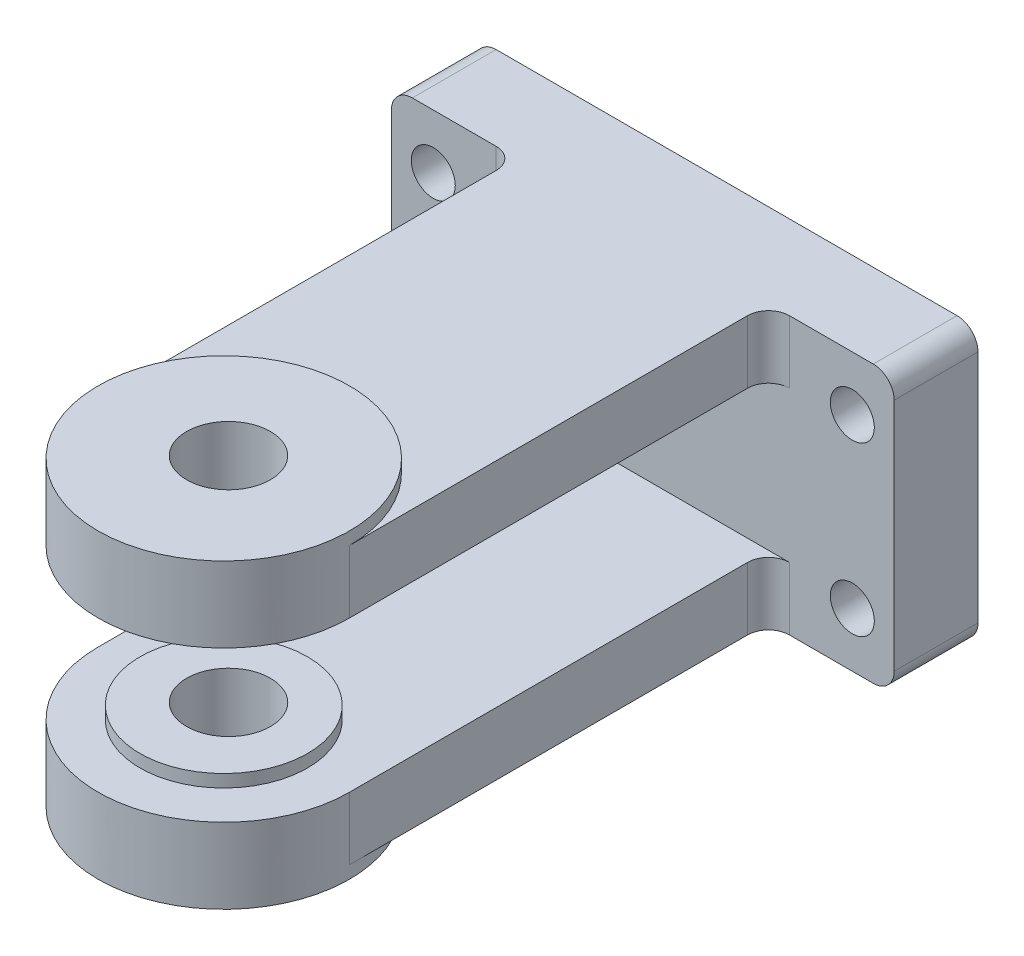
from build123d import *

# Parameters (mm, degrees)
Y_KSEKLIK_EKSTR_ZYON1_DEPTH = 20
Y_KSEKLIK_EKSTR_ZYON2_DEPTH = 15
Y_KSEKLIK_EKSTR_ZYON3_START = 3
IZIM3_R                     = 30
Y_KSEKLIK_EKSTR_ZYON3_DEPTH = 3
IZIM4_R                     = 20
Y_KSEKLIK_EKSTR_ZYON4_DEPTH = 3
IZIM5_R                     = 10
KES_EKSTR_ZYON1_DEPTH       = 169.534862862
IZIM6_R                     = 5.25
KES_EKSTR_ZYON2_DEPTH       = 148.634684272
RADYUS1_R                   = 5


with BuildPart() as part:
    # Çizim1 → Yükseklik-Ekstrüzyon1 (new body)
    with BuildSketch(Plane.XY):
        with BuildLine():
            Line((-55, 33), (55, 33))
            ThreePointArc((55, 33), (58.535533906, 31.535533906), (60, 28))
            Line((60, 28), (60, -28))
            ThreePointArc((60, -28), (58.535533906, -31.535533906), (55, -33))
            Line((55, -33), (-55, -33))
            ThreePointArc((-55, -33), (-58.535533906, -31.535533906), (-60, -28))
            Line((-60, -28), (-60, 28))
            ThreePointArc((-60, 28), (-58.535533906, 31.535533906), (-55, 33))
        make_face()
    y_kseklik_ekstr_zyon1 = extrude(amount=Y_KSEKLIK_EKSTR_ZYON1_DEPTH)

    # Çizim2 → Yükseklik-Ekstrüzyon2 (add)
    with BuildSketch(Plane(origin=(0, 33, 0), x_dir=(1, 0, 0), z_dir=(0, 1, 0))):
        with BuildLine():
            Line((-30, -20), (30, -20))
            Line((30, -20), (30, -120))
            ThreePointArc((30, -120), (0, -150), (-30, -120))
            Line((-30, -120), (-30, -20))
        make_face()
    y_kseklik_ekstr_zyon2 = extrude(amount=-Y_KSEKLIK_EKSTR_ZYON2_DEPTH)

    # Çizim3 → Yükseklik-Ekstrüzyon3 (add)
    with BuildSketch(Plane(origin=(0, 33, 0), x_dir=(1, 0, 0), z_dir=(0, 1, 0)).offset(Y_KSEKLIK_EKSTR_ZYON3_START)):
        with Locations((0, -120)):
            Circle(IZIM3_R)
    y_kseklik_ekstr_zyon3 = extrude(amount=-Y_KSEKLIK_EKSTR_ZYON3_DEPTH)

    # Çizim4 → Yükseklik-Ekstrüzyon4 (add)
    with BuildSketch(Plane(origin=(0, 18, 0), x_dir=(-1, 0, 0), z_dir=(0, -1, 0))):
        with Locations((0, -120)):
            Circle(IZIM4_R)
    y_kseklik_ekstr_zyon4 = extrude(amount=Y_KSEKLIK_EKSTR_ZYON4_DEPTH)

    # Çizim5 → Kes-Ekstrüzyon1 (cut, through all)
    with BuildSketch(Plane.XZ.offset(-15)):
        with Locations((0, 118.867910889)):
            Circle(IZIM5_R)
    kes_ekstr_zyon1 = extrude(amount=-KES_EKSTR_ZYON1_DEPTH, mode=Mode.SUBTRACT)

    # Aynalama1: Yükseklik-Ekstrüzyon1, Yükseklik-Ekstrüzyon2, Yükseklik-Ekstrüzyon3, Yükseklik-Ekstrüzyon4, Kes-Ekstrüzyon1 across plane
    add(y_kseklik_ekstr_zyon1.mirror(Plane(origin=(0, 0, 0), x_dir=(0, 0, 1), z_dir=(0, -1, 0))))
    add(y_kseklik_ekstr_zyon2.mirror(Plane(origin=(0, 0, 0), x_dir=(0, 0, 1), z_dir=(0, -1, 0))))
    add(y_kseklik_ekstr_zyon3.mirror(Plane(origin=(0, 0, 0), x_dir=(0, 0, 1), z_dir=(0, -1, 0))))
    add(y_kseklik_ekstr_zyon4.mirror(Plane(origin=(0, 0, 0), x_dir=(0, 0, 1), z_dir=(0, -1, 0))))
    add(kes_ekstr_zyon1.mirror(Plane(origin=(0, 0, 0), x_dir=(0, 0, 1), z_dir=(0, -1, 0))), mode=Mode.SUBTRACT)

    # Çizim6 → Kes-Ekstrüzyon2 (cut, through all)
    with BuildSketch(Plane.XY.offset(20)):
        with Locations((-50, 20)):
            Circle(IZIM6_R)
        with Locations((-50, -20)):
            Circle(IZIM6_R)
        with Locations((50, -20)):
            Circle(IZIM6_R)
        with Locations((50, 20)):
            Circle(IZIM6_R)
    extrude(amount=-KES_EKSTR_ZYON2_DEPTH, mode=Mode.SUBTRACT)

    # Radyus1
    radyus1_edges = [part.edges().sort_by_distance(p)[0] for p in [
        (-30, -25.5, 20),
        (-30, 25.5, 20),
        (30, -25.5, 20),
        (30, 25.5, 20),
    ]]
    fillet(radyus1_edges, radius=RADYUS1_R)


solid = part.part
